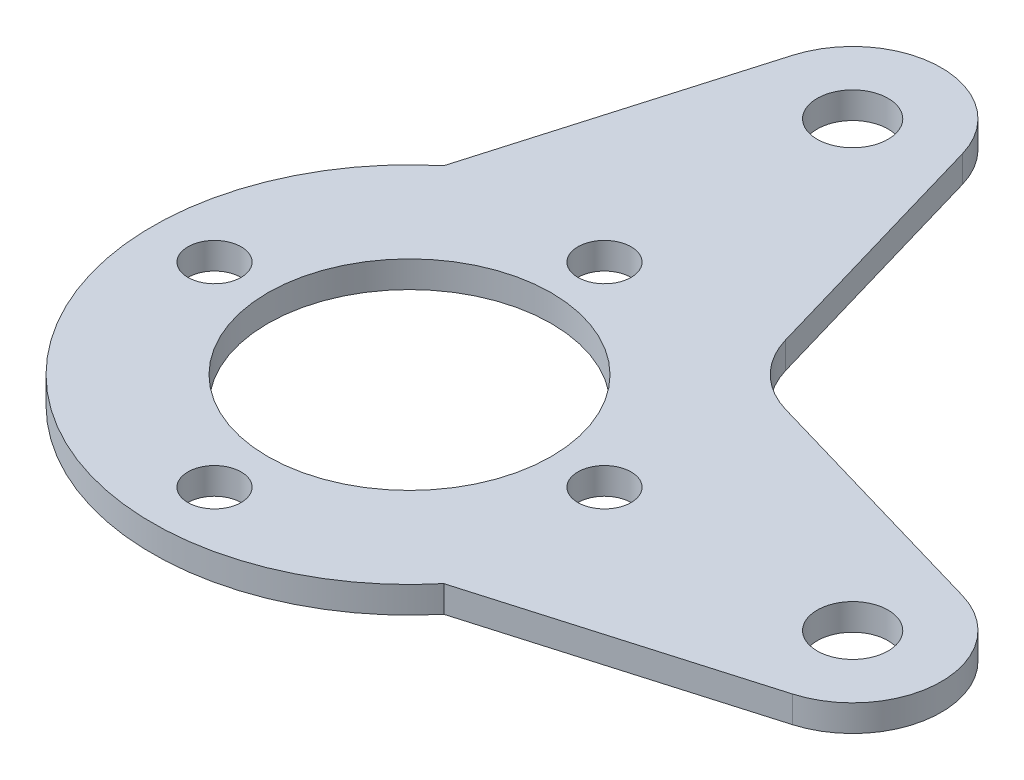
from build123d import *

# Parameters (mm, degrees)
SZKIC1_R                    = 4
SZKIC1_R_2                  = 16
SZKIC1_R_3                  = 3
DODANIE_WYCI_GNI_CIE1_DEPTH = 3


with BuildPart() as part:
    # Szkic1 → Dodanie-wyciągnięcie1 (new body)
    with BuildSketch(Plane(origin=(0, 0, 0), x_dir=(1, 0, 0), z_dir=(0, 1, 0))):
        with BuildLine():
            Line((62.508814697, 30.245420738), (92.961146924, 39.127350971))
            ThreePointArc((92.961146924, 39.127350971), (100.161146924, 48.727350971), (92.961146924, 58.327350971))
            Line((92.961146924, 58.327350971), (64.780501763, 66.546705809))
            ThreePointArc((64.780501763, 66.546705809), (60.509433951, 69.075637998), (57.980501763, 73.346705809))
            Line((57.980501763, 73.346705809), (49.761146924, 101.527350971))
            ThreePointArc((49.761146924, 101.527350971), (40.161146924, 108.727350971), (30.561146924, 101.527350971))
            Line((30.561146924, 101.527350971), (21.679216691, 71.075018743))
            ThreePointArc((21.679216691, 71.075018743), (19.65505027, 28.221254316), (62.508814697, 30.245420738))
        make_face()
        with Locations((40.161146924, 98.727350971)):
            Circle(SZKIC1_R, mode=Mode.SUBTRACT)
        with Locations((90.161146924, 48.727350971)):
            Circle(SZKIC1_R, mode=Mode.SUBTRACT)
        with Locations((40.161146924, 48.727350971)):
            Circle(SZKIC1_R_2, mode=Mode.SUBTRACT)
        with Locations((40.161146924, 70.727350971)):
            Circle(SZKIC1_R_3, mode=Mode.SUBTRACT)
        with Locations((18.161146924, 48.727350971)):
            Circle(SZKIC1_R_3, mode=Mode.SUBTRACT)
        with Locations((40.161146924, 26.727350971)):
            Circle(SZKIC1_R_3, mode=Mode.SUBTRACT)
        with Locations((62.161146924, 48.727350971)):
            Circle(SZKIC1_R_3, mode=Mode.SUBTRACT)
    extrude(amount=DODANIE_WYCI_GNI_CIE1_DEPTH)


solid = part.part
